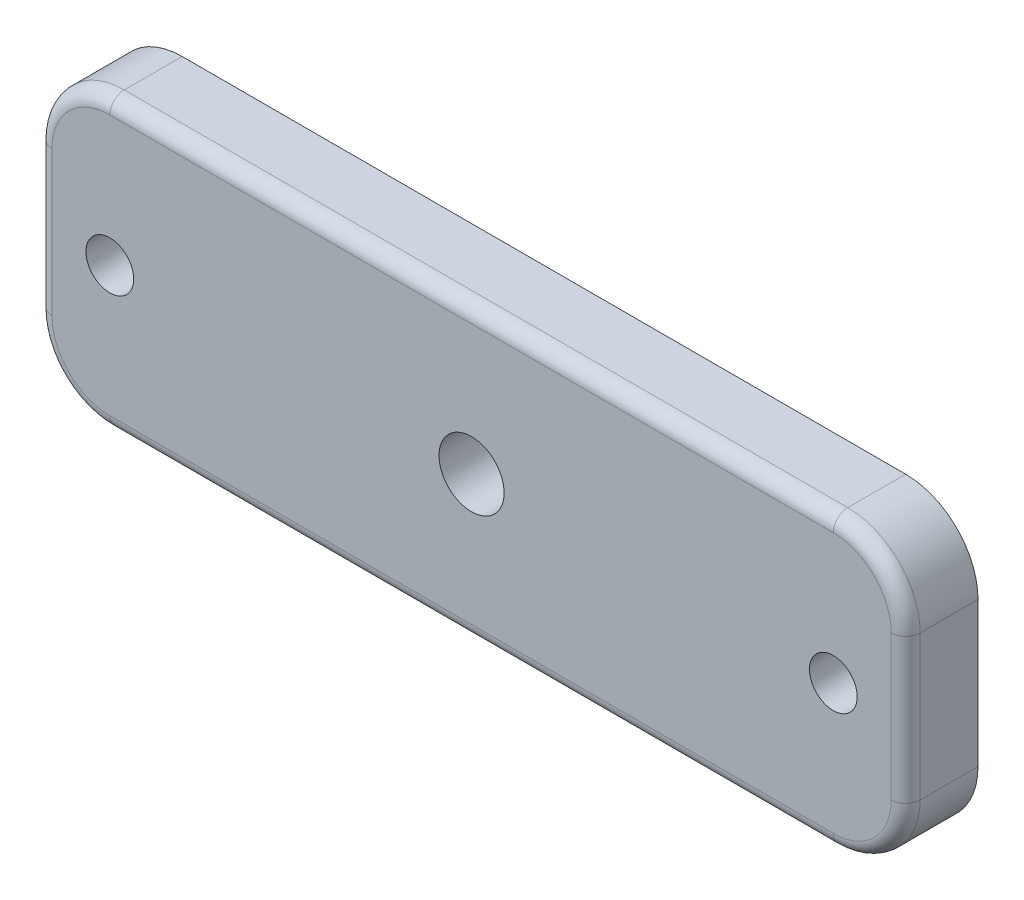
from build123d import *

# Parameters (mm, degrees)
ESQUISSE1_W        = 60
ESQUISSE1_H        = 20
ESQUISSE1_R        = 2.25
ESQUISSE1_R_2      = 1.65
BOSS_EXTRU_1_DEPTH = 5
CONG_1_R           = 1
CONG_3_R           = 5


with BuildPart() as part:
    # Esquisse1 → Boss.-Extru.1 (new body)
    with BuildSketch(Plane.XY):
        with Locations((0, -10)):
            Rectangle(ESQUISSE1_W, ESQUISSE1_H)
        with Locations((0, -10)):
            Circle(ESQUISSE1_R, mode=Mode.SUBTRACT)
        with Locations((25, -10)):
            Circle(ESQUISSE1_R_2, mode=Mode.SUBTRACT)
        with Locations((-25, -10)):
            Circle(ESQUISSE1_R_2, mode=Mode.SUBTRACT)
    extrude(amount=BOSS_EXTRU_1_DEPTH)

    # Congé1
    cong_1_edges = [part.edges().sort_by_distance(p)[0] for p in [
        (-30, -10, 5),
        (0, -20, 5),
        (30, -10, 5),
        (0, 0, 5),
    ]]
    fillet(cong_1_edges, radius=CONG_1_R)

    # Congé3
    # the kernel refuses this fillet: 5 mm, written as the material it takes off along each edge
    with BuildSketch(Plane(origin=(-25, -5, 5), x_dir=(0, 1, 0), z_dir=(1, 0, 0))) as cong_3_piece_1:
        with BuildLine():
            CenterArc((4, -1), 1, 0, 90)
            Line((5, -1), (5, 0))
            Line((5, 0), (4, 0))
        make_face()
    revolve(axis=Axis((-25, -5, 5), (0, 0, 1)), revolution_arc=90, mode=Mode.SUBTRACT)
    with BuildSketch(Plane(origin=(25, -5, 5), x_dir=(1, 0, 0), z_dir=(0, -1, 0))) as cong_3_piece_2:
        with BuildLine():
            CenterArc((4, -1), 1, 0, 90)
            Line((5, -1), (5, 0))
            Line((5, 0), (4, 0))
        make_face()
    revolve(axis=Axis((25, -5, 5), (0, 0, 1)), revolution_arc=90, mode=Mode.SUBTRACT)
    with BuildSketch(Plane(origin=(-25, -15, 5), x_dir=(-1, 0, 0), z_dir=(0, 1, 0))) as cong_3_piece_3:
        with BuildLine():
            CenterArc((4, -1), 1, 0, 90)
            Line((5, -1), (5, 0))
            Line((5, 0), (4, 0))
        make_face()
    revolve(axis=Axis((-25, -15, 5), (0, 0, 1)), revolution_arc=90, mode=Mode.SUBTRACT)
    with BuildSketch(Plane(origin=(25, -15, 5), x_dir=(0, -1, 0), z_dir=(-1, 0, 0))) as cong_3_piece_4:
        with BuildLine():
            CenterArc((4, -1), 1, 0, 90)
            Line((5, -1), (5, 0))
            Line((5, 0), (4, 0))
        make_face()
    revolve(axis=Axis((25, -15, 5), (0, 0, 1)), revolution_arc=90, mode=Mode.SUBTRACT)
    with BuildSketch(Plane(origin=(30, -20, -12.5), x_dir=(0, 1, 0), z_dir=(0, 0, 1)), Plane(origin=(30, 0, -12.5), x_dir=(-1, 0, 0), z_dir=(0, 0, 1))) as cong_3_piece_5:
        with BuildLine():
            CenterArc((CONG_3_R, CONG_3_R), CONG_3_R, 180, 90)
            Line((0, CONG_3_R), (0, 0))
            Line((0, 0), (CONG_3_R, 0))
        make_face()
    extrude(amount=17.5, mode=Mode.SUBTRACT)
    with BuildSketch(Plane(origin=(-30, -20, -12.5), x_dir=(0, 1, 0), z_dir=(0, 0, 1)), Plane(origin=(-30, 0, -12.5), x_dir=(1, 0, 0), z_dir=(0, 0, 1))) as cong_3_piece_6:
        with BuildLine():
            CenterArc((CONG_3_R, -CONG_3_R), CONG_3_R, 90, 90)
            Line((0, -CONG_3_R), (0, 0))
            Line((0, 0), (CONG_3_R, 0))
        make_face()
    extrude(amount=17.5, mode=Mode.SUBTRACT)


solid = part.part
